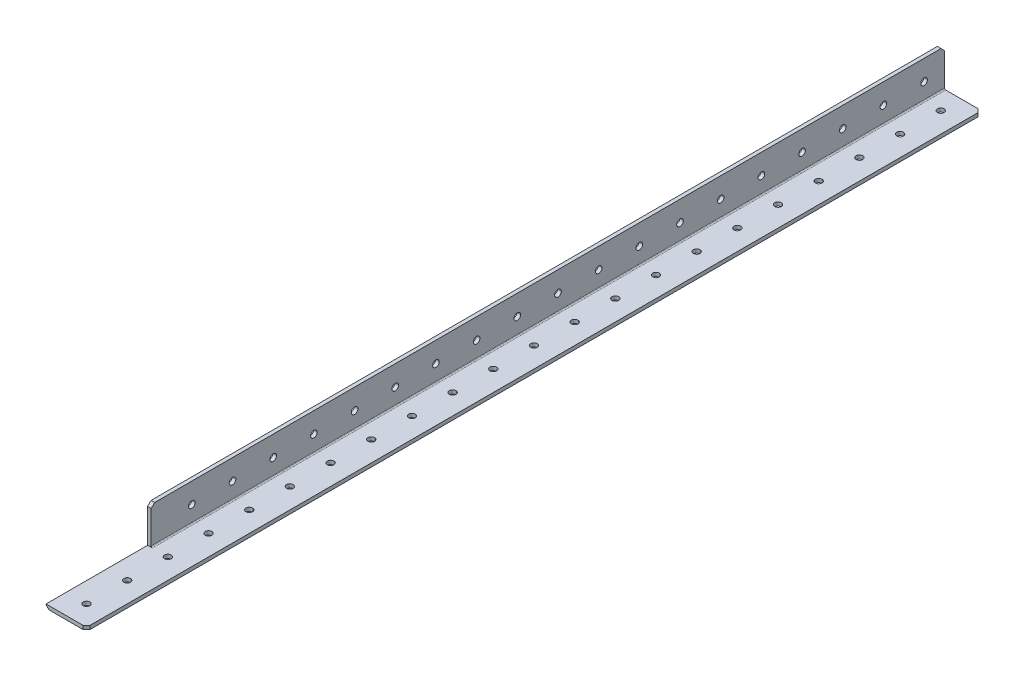
from build123d import *

# Parameters (mm, degrees)
CUT_EXTRUDE1_OUTLINE_R   = 2.0701
CUT_EXTRUDE1_DEPTH       = 3.0988
CUT_EXTRUDE1_START       = 2.286
CUT_EXTRUDE1_2_OUTLINE_W = 2.286
CUT_EXTRUDE1_2_OUTLINE_H = 558.8
CUT_EXTRUDE1_2_DEPTH     = 23.114
CUT_EXTRUDE1_START_2     = 3.0988
CUT_EXTRUDE1_3_OUTLINE_W = 0.8128
CUT_EXTRUDE1_3_OUTLINE_H = 558.8
CUT_EXTRUDE1_3_DEPTH     = 22.3012
CUT_EXTRUDE1_4_OUTLINE_R = 2.0701
CUT_EXTRUDE1_4_DEPTH     = 2.286
CUT_EXTRUDE1_START_3     = -749.3
CUT_EXTRUDE1_5_DEPTH     = 558.8
CUT_EXTRUDE1_START_4     = 546.268979845
CUT_EXTRUDE1_6_OUTLINE_W = 4
CUT_EXTRUDE1_6_OUTLINE_H = 359
CUT_EXTRUDE1_6_DEPTH     = 2.731020155
CHAMFER1_SIZE            = 2.159
CUT_EXTRUDE2_START       = -2.286
SKETCH2_W                = 63.5
SKETCH2_H                = 23.114
CUT_EXTRUDE2_DEPTH       = 3.0988
CHAMFER2_SIZE            = 2.159
BOSS_EXTRUDE1_START      = -2.286
BOSS_EXTRUDE1_DEPTH      = 2.286


with BuildPart() as part:
    # Cut-Extrude1: read off the stored shape, not the designer's step
    # Cut-Extrude1 outline → Cut-Extrude1 (new body)
    with BuildSketch(Plane(origin=(0, 0, 0), x_dir=(1, 0, 0), z_dir=(0, 1, 0))):
        Polygon((0, 749.3), (0, 190.5), (25.4, 190.5), (25.4, 747.141), (23.241, 749.3), align=None)
        with Locations((12.7, 736.6)):
            Circle(CUT_EXTRUDE1_OUTLINE_R, mode=Mode.SUBTRACT)
        with Locations((12.7, 203.2)):
            Circle(CUT_EXTRUDE1_OUTLINE_R, mode=Mode.SUBTRACT)
        with Locations((12.7, 228.6)):
            Circle(CUT_EXTRUDE1_OUTLINE_R, mode=Mode.SUBTRACT)
        with Locations((12.7, 254)):
            Circle(CUT_EXTRUDE1_OUTLINE_R, mode=Mode.SUBTRACT)
        with Locations((12.7, 279.4)):
            Circle(CUT_EXTRUDE1_OUTLINE_R, mode=Mode.SUBTRACT)
        with Locations((12.7, 304.8)):
            Circle(CUT_EXTRUDE1_OUTLINE_R, mode=Mode.SUBTRACT)
        with Locations((12.7, 330.2)):
            Circle(CUT_EXTRUDE1_OUTLINE_R, mode=Mode.SUBTRACT)
        with Locations((12.7, 355.6)):
            Circle(CUT_EXTRUDE1_OUTLINE_R, mode=Mode.SUBTRACT)
        with Locations((12.7, 381)):
            Circle(CUT_EXTRUDE1_OUTLINE_R, mode=Mode.SUBTRACT)
        with Locations((12.7, 406.4)):
            Circle(CUT_EXTRUDE1_OUTLINE_R, mode=Mode.SUBTRACT)
        with Locations((12.7, 431.8)):
            Circle(CUT_EXTRUDE1_OUTLINE_R, mode=Mode.SUBTRACT)
        with Locations((12.7, 457.2)):
            Circle(CUT_EXTRUDE1_OUTLINE_R, mode=Mode.SUBTRACT)
        with Locations((12.7, 482.6)):
            Circle(CUT_EXTRUDE1_OUTLINE_R, mode=Mode.SUBTRACT)
        with Locations((12.7, 508)):
            Circle(CUT_EXTRUDE1_OUTLINE_R, mode=Mode.SUBTRACT)
        with Locations((12.7, 533.4)):
            Circle(CUT_EXTRUDE1_OUTLINE_R, mode=Mode.SUBTRACT)
        with Locations((12.7, 558.8)):
            Circle(CUT_EXTRUDE1_OUTLINE_R, mode=Mode.SUBTRACT)
        with Locations((12.7, 584.2)):
            Circle(CUT_EXTRUDE1_OUTLINE_R, mode=Mode.SUBTRACT)
        with Locations((12.7, 609.6)):
            Circle(CUT_EXTRUDE1_OUTLINE_R, mode=Mode.SUBTRACT)
        with Locations((12.7, 635)):
            Circle(CUT_EXTRUDE1_OUTLINE_R, mode=Mode.SUBTRACT)
        with Locations((12.7, 660.4)):
            Circle(CUT_EXTRUDE1_OUTLINE_R, mode=Mode.SUBTRACT)
        with Locations((12.7, 685.8)):
            Circle(CUT_EXTRUDE1_OUTLINE_R, mode=Mode.SUBTRACT)
        with Locations((12.7, 711.2)):
            Circle(CUT_EXTRUDE1_OUTLINE_R, mode=Mode.SUBTRACT)
    extrude(amount=CUT_EXTRUDE1_DEPTH)

    # Cut-Extrude1 2 outline → Cut-Extrude1 2 (add)
    with BuildSketch(Plane(origin=(0, 0, 0), x_dir=(1, 0, 0), z_dir=(0, 1, 0)).offset(CUT_EXTRUDE1_START)):
        with Locations((1.143, 469.9)):
            Rectangle(CUT_EXTRUDE1_2_OUTLINE_W, CUT_EXTRUDE1_2_OUTLINE_H)
    extrude(amount=CUT_EXTRUDE1_2_DEPTH)

    # Cut-Extrude1 3 outline → Cut-Extrude1 3 (cut)
    with BuildSketch(Plane.YZ.offset(CUT_EXTRUDE1_START_2)):
        with Locations((2.6924, -469.9)):
            Rectangle(CUT_EXTRUDE1_3_OUTLINE_W, CUT_EXTRUDE1_3_OUTLINE_H)
    extrude(amount=CUT_EXTRUDE1_3_DEPTH, mode=Mode.SUBTRACT)

    # Cut-Extrude1 4 outline → Cut-Extrude1 4 (cut)
    with BuildSketch(Plane.YZ):
        with Locations((12.7, -736.6)):
            Circle(CUT_EXTRUDE1_4_OUTLINE_R)
        with Locations((12.7, -711.2)):
            Circle(CUT_EXTRUDE1_4_OUTLINE_R)
        with Locations((12.7, -685.8)):
            Circle(CUT_EXTRUDE1_4_OUTLINE_R)
        with Locations((12.7, -660.4)):
            Circle(CUT_EXTRUDE1_4_OUTLINE_R)
        with Locations((12.7, -635)):
            Circle(CUT_EXTRUDE1_4_OUTLINE_R)
        with Locations((12.7, -609.6)):
            Circle(CUT_EXTRUDE1_4_OUTLINE_R)
        with Locations((12.7, -584.2)):
            Circle(CUT_EXTRUDE1_4_OUTLINE_R)
        with Locations((12.7, -558.8)):
            Circle(CUT_EXTRUDE1_4_OUTLINE_R)
        with Locations((12.7, -533.4)):
            Circle(CUT_EXTRUDE1_4_OUTLINE_R)
        with Locations((12.7, -508)):
            Circle(CUT_EXTRUDE1_4_OUTLINE_R)
        with Locations((12.7, -482.6)):
            Circle(CUT_EXTRUDE1_4_OUTLINE_R)
        with Locations((12.7, -457.2)):
            Circle(CUT_EXTRUDE1_4_OUTLINE_R)
        with Locations((12.7, -431.8)):
            Circle(CUT_EXTRUDE1_4_OUTLINE_R)
        with Locations((12.7, -406.4)):
            Circle(CUT_EXTRUDE1_4_OUTLINE_R)
        with Locations((12.7, -381)):
            Circle(CUT_EXTRUDE1_4_OUTLINE_R)
        with Locations((12.7, -355.6)):
            Circle(CUT_EXTRUDE1_4_OUTLINE_R)
        with Locations((12.7, -330.2)):
            Circle(CUT_EXTRUDE1_4_OUTLINE_R)
        with Locations((12.7, -304.8)):
            Circle(CUT_EXTRUDE1_4_OUTLINE_R)
        with Locations((12.7, -279.4)):
            Circle(CUT_EXTRUDE1_4_OUTLINE_R)
        with Locations((12.7, -254)):
            Circle(CUT_EXTRUDE1_4_OUTLINE_R)
        with Locations((12.7, -228.6)):
            Circle(CUT_EXTRUDE1_4_OUTLINE_R)
        with Locations((12.7, -203.2)):
            Circle(CUT_EXTRUDE1_4_OUTLINE_R)
    extrude(amount=CUT_EXTRUDE1_4_DEPTH, mode=Mode.SUBTRACT)

    # Cut-Extrude1 5 outline → Cut-Extrude1 5 (cut)
    with BuildSketch(Plane.XY.offset(CUT_EXTRUDE1_START_3)):
        with BuildLine():
            ThreePointArc((3.0988, 0), (0.907617506, 0.907617506), (0, 3.0988))
            Line((0, 3.0988), (0, 0))
            Line((0, 0), (3.0988, 0))
        make_face()
        with BuildLine():
            Line((3.0988, 3.0988), (2.286, 3.0988))
            ThreePointArc((2.286, 3.0988), (2.524063608, 2.524063608), (3.0988, 2.286))
            Line((3.0988, 2.286), (3.0988, 3.0988))
        make_face()
    extrude(amount=CUT_EXTRUDE1_5_DEPTH, mode=Mode.SUBTRACT)

    # Cut-Extrude1 6 outline → Cut-Extrude1 6 (cut)
    with BuildSketch(Plane(origin=(0, 0, 0), x_dir=(1, 0, 0), z_dir=(0, 0.7071067811865511, -0.7071067811865441)).offset(CUT_EXTRUDE1_START_4)):
        with Locations((2, 349.5)):
            Rectangle(CUT_EXTRUDE1_6_OUTLINE_W, CUT_EXTRUDE1_6_OUTLINE_H)
    extrude(amount=CUT_EXTRUDE1_6_DEPTH, mode=Mode.SUBTRACT)

    # Chamfer1
    chamfer1_edges = [part.edges().sort_by_distance(p)[0] for p in [
        (1.143, 25.4, -190.5),
        (25.4, 1.143, -190.5),
    ]]
    chamfer(chamfer1_edges, length=CHAMFER1_SIZE)

    # Sketch2 → Cut-Extrude2 (cut)
    with BuildSketch(Plane(origin=(2.286, 0, 0), x_dir=(0, 0, -1), z_dir=(1, 0, 0)).offset(CUT_EXTRUDE2_START)):
        with Locations((222.25, 13.843)):
            Rectangle(SKETCH2_W, SKETCH2_H)
    extrude(amount=CUT_EXTRUDE2_DEPTH, mode=Mode.SUBTRACT)

    # Chamfer2
    chamfer2_edges = [part.edges().sort_by_distance(p)[0] for p in [
        (1.143, 25.4, -254),
    ]]
    chamfer(chamfer2_edges, length=CHAMFER2_SIZE)

    # Sketch3 → Boss-Extrude1 (add)
    with BuildSketch(Plane(origin=(2.286, 0, 0), x_dir=(0, 0, -1), z_dir=(1, 0, 0)).offset(BOSS_EXTRUDE1_START)):
        with BuildLine():
            Line((254, 10.6299), (254, 14.7701))
            ThreePointArc((254, 14.7701), (256.0701, 12.7), (254, 10.6299))
        make_face()
    extrude(amount=BOSS_EXTRUDE1_DEPTH)


solid = part.part
